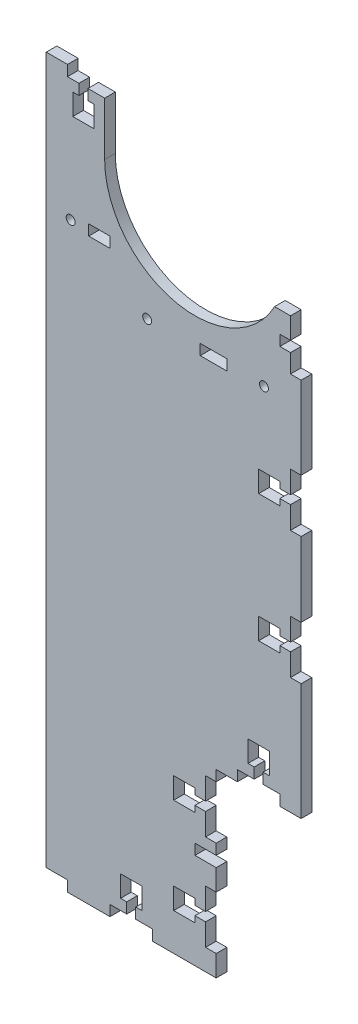
from build123d import *

# Parameters (mm, degrees)
SKETCH1_W               = 150
SKETCH1_H               = 200
BOSS_EXTRUDE1_DEPTH     = 5
SKETCH2_W               = 45
SKETCH2_H               = 50
CUT_EXTRUDE1_DEPTH      = 10
SKETCH3_W               = 35
SKETCH3_H               = 5
BOSS_EXTRUDE2_DEPTH     = 5
SKETCH5_W               = 5
SKETCH5_H               = 45
BOSS_EXTRUDE3_DEPTH     = 5
SKETCH6_W               = 45
SKETCH6_H               = 15
BOSS_EXTRUDE4_DEPTH     = 5
SKETCH7_W               = 5
SKETCH7_H               = 25
SKETCH7_H_2             = 50
BOSS_EXTRUDE5_DEPTH     = 5
SKETCH8_W               = 35
SKETCH8_H               = 250
CUT_EXTRUDE3_DEPTH      = 10
SKETCH9_R               = 2.1
CUT_EXTRUDE4_DEPTH      = 5
BOSS_EXTRUDE6_DEPTH     = 5
CUT_EXTRUDE5_DEPTH      = 5
SKETCH12_W              = 4.2
SKETCH12_H              = 5
CUT_EXTRUDE6_DEPTH      = 5
SKETCH13_W              = 5
SKETCH13_H              = 35
SKETCH13_H_2            = 45
BOSS_EXTRUDE7_DEPTH     = 5
SKETCH14_W              = 5
SKETCH14_H              = 25
CUT_EXTRUDE7_DEPTH      = 5
SKETCH15_W              = 20
SKETCH15_H              = 5
CUT_EXTRUDE8_DEPTH      = 5
SKETCH16_W              = 5
SKETCH16_H              = 25
CUT_EXTRUDE9_DEPTH      = 5
BOSS_EXTRUDE8_START     = -5
BOSS_EXTRUDE8_OUTLINE_R = 2.1
BOSS_EXTRUDE8_OUTLINE_W = 10
BOSS_EXTRUDE8_OUTLINE_H = 5
BOSS_EXTRUDE8_DEPTH     = 5
SKETCH18_W              = 10
SKETCH18_H              = 10
SKETCH18_W_2            = 5
SKETCH18_H_2            = 4
CUT_EXTRUDE10_DEPTH     = 5
CUT_EXTRUDE11_DEPTH     = 10
SKETCH20_W              = 10
SKETCH20_H              = 1.8
CUT_EXTRUDE13_DEPTH     = 10
SKETCH21_R              = 42.5
SKETCH21_R_2            = 3
CUT_EXTRUDE14_DEPTH     = 5
BOSS_EXTRUDE9_DEPTH     = 5
BOSS_EXTRUDE10_DEPTH    = 5
SKETCH24_R              = 2.1
BOSS_EXTRUDE11_DEPTH    = 5
SKETCH25_R              = 2.1
CUT_EXTRUDE15_DEPTH     = 5


# Read off the part's stored shape, not the designer's step: Boss-Extrude8
with BuildPart() as part:
    # Sketch1 → Boss-Extrude1 (new body)
    with BuildSketch(Plane.XY):
        with Locations((-75, 100)):
            Rectangle(SKETCH1_W, SKETCH1_H)
    extrude(amount=BOSS_EXTRUDE1_DEPTH)

    # Sketch2 → Cut-Extrude1 (cut)
    with BuildSketch(Plane.XY.offset(5)):
        with Locations((-22.5, 25)):
            Rectangle(SKETCH2_W, SKETCH2_H)
    extrude(amount=-CUT_EXTRUDE1_DEPTH, mode=Mode.SUBTRACT)

    # Sketch3 → Boss-Extrude2 (add)
    with BuildSketch(Plane(origin=(0, 0, 0), x_dir=(-1, 0, 0), z_dir=(0, 0, -1))):
        with Locations((65, 202.5)):
            Rectangle(SKETCH3_W, SKETCH3_H)
    extrude(amount=-BOSS_EXTRUDE2_DEPTH)

    # Sketch5 → Boss-Extrude3 (add)
    with BuildSketch(Plane.XY.offset(5)):
        Polygon((-50, 0), (-150, 0), (-150, -50), (-130, -50), (-130, -45), (-110, -45), (-110, -50), (-90, -50), (-90, -45), (-70, -45), (-70, -50), (-50, -50), (-50, -5), align=None)
        with Locations((-47.5, -27.5)):
            Rectangle(SKETCH5_W, SKETCH5_H)
    extrude(amount=-BOSS_EXTRUDE3_DEPTH)

    # Sketch6 → Boss-Extrude4 (add)
    with BuildSketch(Plane.XY.offset(5)):
        with Locations((-22.5, 42.5)):
            Rectangle(SKETCH6_W, SKETCH6_H)
    extrude(amount=-BOSS_EXTRUDE4_DEPTH)

    # Sketch7 → Boss-Extrude5 (add)
    with BuildSketch(Plane(origin=(0, 0, 0), x_dir=(-1, 0, 0), z_dir=(0, 0, -1))):
        with Locations((152.5, 27.5)):
            Rectangle(SKETCH7_W, SKETCH7_H)
        with Locations((152.5, 130)):
            Rectangle(SKETCH7_W, SKETCH7_H_2)
    extrude(amount=-BOSS_EXTRUDE5_DEPTH)

    # Sketch8 → Cut-Extrude3 (cut)
    with BuildSketch(Plane(origin=(0, 0, 0), x_dir=(-1, 0, 0), z_dir=(0, 0, -1))):
        with Locations((137.5, 75)):
            Rectangle(SKETCH8_W, SKETCH8_H)
    extrude(amount=-CUT_EXTRUDE3_DEPTH, mode=Mode.SUBTRACT)

    # Sketch9 → Cut-Extrude4 (cut)
    with BuildSketch(Plane.XY.offset(5)):
        with Locations((-72.5, 202.5)):
            Circle(SKETCH9_R)
    extrude(amount=-CUT_EXTRUDE4_DEPTH, mode=Mode.SUBTRACT)

    # Sketch10 → Boss-Extrude6 (add)
    with BuildSketch(Plane.XY.offset(5)):
        with BuildLine():
            Line((-76.830127019, 205), (-68.169872981, 205))
            ThreePointArc((-68.169872981, 205), (-72.5, 207.5), (-76.830127019, 205))
        make_face()
    extrude(amount=-BOSS_EXTRUDE6_DEPTH)

    # Sketch11 → Cut-Extrude5 (cut)
    with BuildSketch(Plane(origin=(0, 0, 0), x_dir=(-1, 0, 0), z_dir=(0, 0, -1))):
        with BuildLine():
            Line((21.830127019, 200), (13.169872981, 200))
            ThreePointArc((13.169872981, 200), (17.5, 197.5), (21.830127019, 200))
        make_face()
    extrude(amount=-CUT_EXTRUDE5_DEPTH, mode=Mode.SUBTRACT)

    # Sketch12 → Cut-Extrude6 (cut)
    with BuildSketch(Plane(origin=(0, 0, 0), x_dir=(-1, 0, 0), z_dir=(0, 0, -1))):
        Polygon((75, -40), (77.9, -40), (82.1, -40), (85, -40), (85, -30), (75, -30), align=None)
        with Locations((80, -42.5)):
            Rectangle(SKETCH12_W, SKETCH12_H)
    extrude(amount=-CUT_EXTRUDE6_DEPTH, mode=Mode.SUBTRACT)

    # Sketch13 → Boss-Extrude7 (add)
    with BuildSketch(Plane(origin=(-45, 0, 0), x_dir=(0, 0, -1), z_dir=(1, 0, 0))):
        with Locations((-2.5, 17.5)):
            Rectangle(SKETCH13_W, SKETCH13_H)
        with Locations((-2.5, -27.5)):
            Rectangle(SKETCH13_W, SKETCH13_H_2)
    extrude(amount=BOSS_EXTRUDE7_DEPTH)

    # Sketch14 → Cut-Extrude7 (cut)
    with BuildSketch(Plane(origin=(0, 0, 0), x_dir=(-1, 0, 0), z_dir=(0, 0, -1))):
        with Locations((42.5, -27.5)):
            Rectangle(SKETCH14_W, SKETCH14_H)
        with Locations((42.5, 17.5)):
            Rectangle(SKETCH14_W, SKETCH14_H)
    extrude(amount=-CUT_EXTRUDE7_DEPTH, mode=Mode.SUBTRACT)

    # Sketch15 → Cut-Extrude8 (cut)
    with BuildSketch(Plane(origin=(0, 0, 0), x_dir=(-1, 0, 0), z_dir=(0, 0, -1))):
        with Locations((20, 37.5)):
            Rectangle(SKETCH15_W, SKETCH15_H)
    extrude(amount=-CUT_EXTRUDE8_DEPTH, mode=Mode.SUBTRACT)

    # Sketch16 → Cut-Extrude9 (cut)
    with BuildSketch(Plane.XY.offset(5)):
        with Locations((-2.5, 102.5)):
            Rectangle(SKETCH16_W, SKETCH16_H)
        with Locations((-2.5, 162.5)):
            Rectangle(SKETCH16_W, SKETCH16_H)
    extrude(amount=-CUT_EXTRUDE9_DEPTH, mode=Mode.SUBTRACT)

    # Boss-Extrude8 outline → Boss-Extrude8 (add)
    with BuildSketch(Plane.XY.offset(5).offset(BOSS_EXTRUDE8_START)):
        with BuildLine():
            Line((0, 200), (0, 213.75))
            Line((0, 213.75), (-5, 213.75))
            Line((-5, 213.75), (-5, 222.5))
            Line((-5, 222.5), (-10, 222.5))
            Line((-10, 222.5), (-10, 227.5))
            Line((-10, 227.5), (-20, 227.5))
            Line((-20, 227.5), (-20, 222.5))
            Line((-20, 222.5), (-28.711001812, 222.5))
            ThreePointArc((-28.711001812, 222.5), (-66.079667431, 219.821548079), (-90, 248.65571123))
            Line((-90, 248.65571123), (-90, 282.5))
            Line((-90, 282.5), (-100.4, 282.5))
            Line((-100.4, 282.5), (-100.4, 277.5))
            Line((-100.4, 277.5), (-97.5, 277.5))
            Line((-97.5, 277.5), (-97.5, 269.3))
            Line((-97.5, 269.3), (-107.5, 269.3))
            Line((-107.5, 269.3), (-107.5, 277.5))
            Line((-107.5, 277.5), (-104.6, 277.5))
            Line((-104.6, 277.5), (-104.6, 282.5))
            Line((-104.6, 282.5), (-110, 282.5))
            Line((-110, 282.5), (-110, 287.5))
            Line((-110, 287.5), (-120, 287.5))
            Line((-120, 287.5), (-120, 200))
            Line((-120, 200), (-82.5, 200))
            Line((-82.5, 200), (-82.5, 205))
            Line((-82.5, 205), (-76.830127019, 205))
            ThreePointArc((-76.830127019, 205), (-72.5, 207.5), (-68.169872981, 205))
            Line((-68.169872981, 205), (-35, 205))
            Line((-35, 205), (-35, 200))
            Line((-35, 200), (-21.830127019, 200))
            ThreePointArc((-21.830127019, 200), (-17.5, 197.5), (-13.169872981, 200))
            Line((-13.169872981, 200), (0, 200))
        make_face()
        with Locations((-115, 225)):
            Circle(BOSS_EXTRUDE8_OUTLINE_R, mode=Mode.SUBTRACT)
        with Locations((-95, 225)):
            Rectangle(BOSS_EXTRUDE8_OUTLINE_W, BOSS_EXTRUDE8_OUTLINE_H, mode=Mode.SUBTRACT)
        with Locations((-17.5, 202.5)):
            Circle(BOSS_EXTRUDE8_OUTLINE_R, mode=Mode.SUBTRACT)
    extrude(amount=BOSS_EXTRUDE8_DEPTH)

    # Sketch18 → Cut-Extrude10 (cut)
    with BuildSketch(Plane.XY.offset(5)):
        with Locations((-15, 162.5)):
            Rectangle(SKETCH18_W, SKETCH18_H)
        with Locations((-7.5, 162.5)):
            Rectangle(SKETCH18_W_2, SKETCH18_H_2)
        with Locations((-7.5, 102.5)):
            Rectangle(SKETCH18_W_2, SKETCH18_H_2)
        Polygon((-10, 100.5), (-10, 104.5), (-10, 107.5), (-20, 107.5), (-20, 97.5), (-10, 97.5), align=None)
    extrude(amount=-CUT_EXTRUDE10_DEPTH, mode=Mode.SUBTRACT)

    # Sketch19 → Cut-Extrude11 (cut)
    with BuildSketch(Plane(origin=(0, 0, 0), x_dir=(-1, 0, 0), z_dir=(0, 0, -1))):
        Polygon((45, -25.4), (45, -29.6), (50, -29.6), (50, -32.5), (60, -32.5), (60, -22.5), (50, -22.5), (50, -25.4), align=None)
        Polygon((50, 12.5), (60, 12.5), (60, 22.5), (50, 22.5), (50, 19.6), (45, 19.6), (45, 15.4), (50, 15.4), align=None)
        Polygon((17.9, 40), (22.1, 40), (22.1, 45), (25, 45), (25, 55), (15, 55), (15, 45), (17.9, 45), align=None)
    extrude(amount=-CUT_EXTRUDE11_DEPTH, mode=Mode.SUBTRACT)

    # Sketch20 → Cut-Extrude13 (cut)
    with BuildSketch(Plane.XY.offset(5)):
        with Locations((-102.5, 268.4)):
            Rectangle(SKETCH20_W, SKETCH20_H)
    extrude(amount=-CUT_EXTRUDE13_DEPTH, mode=Mode.SUBTRACT)

    # Sketch21 → Cut-Extrude14 (cut)
    # profile 1 of 2: a face of its own
    with BuildSketch(Plane(origin=(0, 0, 0), x_dir=(-1, 0, 0), z_dir=(0, 0, -1))):
        with BuildLine():
            ThreePointArc((84.369317712, 282.5), (90.41624675, 270.644466464), (92.5, 257.5))
            Line((92.5, 257.5), (92.5, 282.5))
            Line((92.5, 282.5), (84.369317712, 282.5))
        make_face()
    # profile 2 of 2: a face of its own
    with BuildSketch(Plane(origin=(0, 0, 0), x_dir=(-1, 0, 0), z_dir=(0, 0, -1))):
        with Locations((50, 257.5)):
            Circle(SKETCH21_R)
        with Locations((50, 257.5)):
            Circle(SKETCH21_R_2, mode=Mode.SUBTRACT)
    extrude(amount=-CUT_EXTRUDE14_DEPTH, mode=Mode.SUBTRACT)

    # Sketch22 → Boss-Extrude9 (add)
    with BuildSketch(Plane(origin=(0, 0, 0), x_dir=(-1, 0, 0), z_dir=(0, 0, -1))):
        with BuildLine():
            Line((20, 222.5), (20, 227.396013553))
            ThreePointArc((20, 227.396013553), (22.834909521, 224.815020892), (25.890873098, 222.5))
            Line((25.890873098, 222.5), (20, 222.5))
        make_face()
    extrude(amount=-BOSS_EXTRUDE9_DEPTH)

    # Sketch23 → Boss-Extrude10 (add)
    with BuildSketch(Plane(origin=(0, 0, 0), x_dir=(-1, 0, 0), z_dir=(0, 0, -1))):
        with BuildLine():
            ThreePointArc((19.896013553, 227.5), (15.830207114, 232.227974871), (12.5, 237.5))
            Line((12.5, 237.5), (5, 237.5))
            Line((5, 237.5), (5, 227.5))
            Line((5, 227.5), (19.896013553, 227.5))
        make_face()
    extrude(amount=-BOSS_EXTRUDE10_DEPTH)

    # Sketch24 → Boss-Extrude11 (add)
    with BuildSketch(Plane(origin=(0, 0, 0), x_dir=(-1, 0, 0), z_dir=(0, 0, -1))):
        with Locations((115, 225)):
            Circle(SKETCH24_R)
    extrude(amount=-BOSS_EXTRUDE11_DEPTH)

    # Sketch25 → Cut-Extrude15 (cut)
    with BuildSketch(Plane(origin=(0, 0, 0), x_dir=(-1, 0, 0), z_dir=(0, 0, -1))):
        with Locations((108.5, 224.863108965)):
            Circle(SKETCH25_R)
    extrude(amount=-CUT_EXTRUDE15_DEPTH, mode=Mode.SUBTRACT)


solid = part.part
